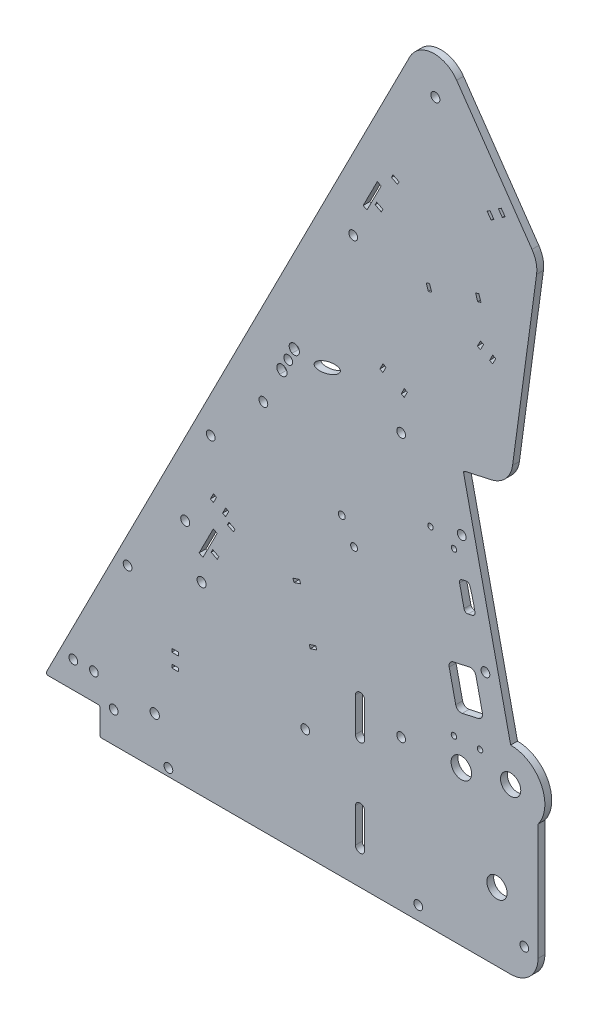
from build123d import *

# Parameters (mm, degrees)
BOSS_EXTRUDE1_DEPTH     = 3.175
SKETCH2_R               = 2.0955
SKETCH2_R_2             = 2.032
SKETCH2_R_3             = 4.699
CUT_EXTRUDE1_DEPTH      = 421.976111717
SKETCH7_R               = 2.159
CUT_EXTRUDE2_DEPTH      = 421.976111717
CUT_EXTRUDE3_REACH      = 422.976
SKETCH10_R              = 2.032
FILLET1_R               = 12.7
FILLET2_R               = 0.79375
SKETCH12_R              = 2.032
CUT_EXTRUDE5_DEPTH      = 411.989226146
CUT_EXTRUDE6_DEPTH      = 411.989226146
CUT_EXTRUDE6_DEPTH_BACK = 411.989226146
SKETCH13_R              = 1.27
SKETCH14_R              = 2.032
SKETCH14_R_2            = 1.6
SKETCH14_RX             = 6.35
SKETCH14_RY             = 2.38125
SKETCH14_W              = 3.175
SKETCH14_H              = 1.5875
CUT_EXTRUDE7_DEPTH      = 411.989226146
SKETCH15_R              = 2.032
CUT_EXTRUDE8_DEPTH      = 411.989226285
FILLET3_R               = 2.54
SKETCH16_R              = 4.7625
CUT_EXTRUDE9_DEPTH      = 411.989226285


with BuildPart() as part:
    # Sketch1 → Boss-Extrude1 (new body)
    with BuildSketch(Plane.XY):
        with BuildLine():
            Line((228.6, -12.7), (228.6, 53.975))
            ThreePointArc((228.6, 53.975), (230.099031657, 70.599515829), (215.9, 79.375))
            Line((215.9, 79.375), (193.909735224, 178.566674323))
            Line((193.909735224, 178.566674323), (215.607913982, 183.377044743))
            Line((215.607913982, 183.377044743), (228.6, 279.4))
            Line((228.6, 279.4), (178.754725958, 351.413083686))
            Line((178.754725958, 351.413083686), (0, 0))
            Line((0, 0), (25.4, 0))
            Line((25.4, 0), (25.4, -12.7))
            Line((25.4, -12.7), (228.6, -12.7))
        make_face()
    extrude(amount=BOSS_EXTRUDE1_DEPTH)

    # Sketch2 → Cut-Extrude1 (cut, through all)
    with BuildSketch(Plane.XY.offset(3.175)):
        with Locations((64.943150167, 94.057839899)):
            Circle(SKETCH2_R)
        with Locations((180.975, 322.164313376)):
            Circle(SKETCH2_R)
        with Locations((72.544547852, 73.173171402)):
            Circle(SKETCH2_R)
        with Locations((193.207821773, 152.394364194)):
            Circle(SKETCH2_R_2)
        with Locations((215.9, 63.5)):
            Circle(SKETCH2_R_3)
        with Locations((173.0375, -6.35)):
            Circle(SKETCH2_R_2)
        with Locations((204.202954161, 102.798527032)):
            Circle(SKETCH2_R_2)
        with Locations((209.55, 19.05)):
            Circle(SKETCH2_R_3)
        with Locations((165.1, 179.3875)):
            Circle(SKETCH2_R_2)
    extrude(amount=-CUT_EXTRUDE1_DEPTH, mode=Mode.SUBTRACT)

    # Sketch7 → Cut-Extrude2 (cut, through all)
    with BuildSketch(Plane.XY.offset(3.175)):
        with Locations((50.8, 9.525)):
            Circle(SKETCH7_R)
        with BuildLine():
            Line((143.891, 3.175), (143.891, 19.05))
            ThreePointArc((143.891, 19.05), (146.05, 21.209), (148.209, 19.05))
            Line((148.209, 19.05), (148.209, 3.175))
            ThreePointArc((148.209, 3.175), (146.05, 1.016), (143.891, 3.175))
        make_face()
        with BuildLine():
            Line((143.891, 47.625), (143.891, 63.5))
            ThreePointArc((143.891, 63.5), (146.05, 65.659), (148.209, 63.5))
            Line((148.209, 63.5), (148.209, 47.625))
            ThreePointArc((148.209, 47.625), (146.05, 45.466), (143.891, 47.625))
        make_face()
    extrude(amount=-CUT_EXTRUDE2_DEPTH, mode=Mode.SUBTRACT)

    # Sketch10 → Cut-Extrude3 (cut, up to next)
    with BuildSketch(Plane.XY.offset(3.175), mode=Mode.PRIVATE) as cut_extrude3_sk1:
        with Locations((165.1, 57.15)):
            Circle(SKETCH10_R)
    cut_extrude3_tool1 = extrude(cut_extrude3_sk1.sketch, amount=-CUT_EXTRUDE3_REACH, mode=Mode.PRIVATE) & part.part
    # Sketch10 → Cut-Extrude3 (cut, up to next)
    with BuildSketch(Plane.XY.offset(3.175), mode=Mode.PRIVATE) as cut_extrude3_sk2:
        with Locations((120.65, 38.1)):
            Circle(SKETCH10_R)
    cut_extrude3_tool2 = extrude(cut_extrude3_sk2.sketch, amount=-CUT_EXTRUDE3_REACH, mode=Mode.PRIVATE) & part.part
    # Sketch10 → Cut-Extrude3 (cut, up to next)
    with BuildSketch(Plane.XY.offset(3.175), mode=Mode.PRIVATE) as cut_extrude3_sk3:
        with Locations((13.046467246, 12.334704411)):
            Circle(SKETCH10_R)
    cut_extrude3_tool3 = extrude(cut_extrude3_sk3.sketch, amount=-CUT_EXTRUDE3_REACH, mode=Mode.PRIVATE) & part.part
    # Sketch10 → Cut-Extrude3 (cut, up to next)
    with BuildSketch(Plane.XY.offset(3.175), mode=Mode.PRIVATE) as cut_extrude3_sk4:
        with Locations((22.571467246, 12.334704411)):
            Circle(SKETCH10_R)
    cut_extrude3_tool4 = extrude(cut_extrude3_sk4.sketch, amount=-CUT_EXTRUDE3_REACH, mode=Mode.PRIVATE) & part.part
    # Sketch10 → Cut-Extrude3 (cut, up to next)
    with BuildSketch(Plane.XY.offset(3.175), mode=Mode.PRIVATE) as cut_extrude3_sk5:
        with Locations((38.211447917, 62.639810909)):
            Circle(SKETCH10_R)
    cut_extrude3_tool5 = extrude(cut_extrude3_sk5.sketch, amount=-CUT_EXTRUDE3_REACH, mode=Mode.PRIVATE) & part.part
    add(cut_extrude3_tool1.solids().sort_by_distance((165.1, 57.15, 3.175))[0], mode=Mode.SUBTRACT)
    add(cut_extrude3_tool2.solids().sort_by_distance((120.65, 38.1, 3.175))[0], mode=Mode.SUBTRACT)
    add(cut_extrude3_tool3.solids().sort_by_distance((13.046467, 12.334704, 3.175))[0], mode=Mode.SUBTRACT)
    add(cut_extrude3_tool4.solids().sort_by_distance((22.571467, 12.334704, 3.175))[0], mode=Mode.SUBTRACT)
    add(cut_extrude3_tool5.solids().sort_by_distance((38.211448, 62.639811, 3.175))[0], mode=Mode.SUBTRACT)

    # Fillet1
    fillet1_edges = [part.edges().sort_by_distance(p)[0] for p in [
        (228.6, -12.7, 1.5875),
        (178.754725958, 351.413083686, 1.5875),
        (215.607913982, 183.377044743, 1.5875),
        (228.6, 279.4, 1.5875),
    ]]
    fillet(fillet1_edges, radius=FILLET1_R)

    # Fillet2
    fillet2_edges = [part.edges().sort_by_distance(p)[0] for p in [
        (25.4, -12.7, 1.5875),
        (25.4, 0, 1.5875),
        (193.909735224, 178.566674323, 1.5875),
        (0, 0, 1.5875),
    ]]
    fillet(fillet2_edges, radius=FILLET2_R)

    # Sketch12 → Cut-Extrude5 (cut, through all)
    with BuildSketch(Plane.XY.offset(3.175)):
        with Locations((31.75, 1.5875)):
            Circle(SKETCH12_R)
        with Locations((222.25, 1.5875)):
            Circle(SKETCH12_R)
        with Locations((57.15, -9.2075)):
            Circle(SKETCH12_R)
    extrude(amount=-CUT_EXTRUDE5_DEPTH, mode=Mode.SUBTRACT)

    # Sketch13 → Cut-Extrude6 (cut, two sides: drawn at the far end of the back side and taken through both)
    with BuildSketch(Plane.XY.offset(3.175).offset(-CUT_EXTRUDE6_DEPTH_BACK)):
        with Locations((189.602197334, 69.980636704)):
            Circle(SKETCH13_R)
        with Locations((201.708862449, 70.509225118)):
            Circle(SKETCH13_R)
        with Locations((178.721644858, 148.532438598)):
            Circle(SKETCH13_R)
        with Locations((189.622629605, 145.09537131)):
            Circle(SKETCH13_R)
        Polygon((186.844411154, 98.950230697), (199.243370445, 101.699013794), (203.36654509, 83.100574858), (190.9675858, 80.351791761), align=None)
        with BuildLine():
            Line((195.12807169, 134.933592333), (193.415301921, 134.553880417))
            ThreePointArc((193.415301921, 134.553880417), (192.420015888, 133.856973634), (192.209029897, 132.660412618))
            Line((192.209029897, 132.660412618), (194.270617219, 123.361193151))
            ThreePointArc((194.270617219, 123.361193151), (194.967524002, 122.365907117), (196.164085018, 122.154921126))
            Line((196.164085018, 122.154921126), (198.109091879, 122.586118766))
            ThreePointArc((198.109091879, 122.586118766), (199.082720469, 123.249946547), (199.330550026, 124.401988414))
            ThreePointArc((199.330550026, 124.401988414), (198.332361402, 129.18494451), (196.979617949, 133.879956193))
            ThreePointArc((196.979617949, 133.879956193), (196.256822614, 134.763465498), (195.12807169, 134.933592333))
        make_face()
    extrude(amount=CUT_EXTRUDE6_DEPTH + CUT_EXTRUDE6_DEPTH_BACK, mode=Mode.SUBTRACT)

    # Sketch14 → Cut-Extrude7 (cut, through all)
    with BuildSketch(Plane.XY.offset(3.175)):
        with Locations((142.875, 247.65)):
            Circle(SKETCH14_R)
        with Locations((112.7125, 182.5625)):
            Circle(SKETCH14_R)
        with Locations((101.196445848, 159.923142748)):
            Circle(SKETCH14_R)
        with Locations((-3.671542088, -75.371419893)):
            Circle(SKETCH14_R_2)
        with Locations((-8.840164817, -85.532391258)):
            Circle(SKETCH14_R_2)
        with Locations((137.55915364, 132.520983187)):
            Circle(SKETCH14_R_2)
        with Locations((143.25915364, 122.648293584)):
            Circle(SKETCH14_R_2)
        with Locations(Location((130.826142263, 188.461522288), (0, 0, -161.961260538))):
            Ellipse(SKETCH14_RX, SKETCH14_RY)
        Polygon((147.482742003, 261.9243054), (154.04689287, 274.828739034), (155.829519425, 273.921963116), (149.265368558, 261.017529483), align=None)
        Polygon((160.590482388, 279.78010172), (161.310235773, 281.195061549), (164.140155429, 279.75555478), (163.420402045, 278.340594951), align=None)
        Polygon((153.789663007, 266.410402556), (156.619582664, 264.970895787), (155.899829279, 263.555935959), (153.069909623, 264.995442728), align=None)
        Polygon((178.26972852, 245.992253978), (179.240391581, 242.969268992), (177.728899089, 242.483937462), (176.758236028, 245.506922447), align=None)
        Polygon((200.609634347, 249.830809719), (199.638971286, 252.853794704), (201.150463779, 253.339126235), (202.12112684, 250.316141249), align=None)
        Polygon((77.953373051, 97.225512031), (79.735999607, 96.318736114), (73.17184874, 83.41430248), (71.389222185, 84.321078398), align=None)
        Polygon((85.216715955, 103.591834546), (84.49696257, 102.176874718), (87.326882227, 100.737367949), (88.046635611, 102.152327777), align=None)
        Polygon((156.643043941, 199.39992488), (158.08255071, 202.229844536), (156.667590882, 202.949597921), (155.228084113, 200.119678264), align=None)
        Polygon((165.132802911, 195.081404573), (166.57230968, 197.911324229), (167.987269508, 197.191570845), (166.547762739, 194.361651188), align=None)
        Polygon((77.696143189, 88.807175554), (76.976389805, 87.392215725), (79.806309461, 85.952708956), (80.526062846, 87.367668785), align=None)
        Polygon((201.915382504, 234.74968075), (200.475875735, 231.919761094), (201.890835563, 231.200007709), (203.330342332, 234.029927366), align=None)
        Polygon((206.135715047, 229.040747556), (207.575221816, 231.870667212), (208.990181645, 231.150913828), (207.550674876, 228.320994171), align=None)
        Polygon((205.013971437, 288.371538288), (206.820969573, 285.760909487), (208.126283974, 286.664408555), (206.319285837, 289.275037356), align=None)
        Polygon((210.235229039, 291.98553456), (212.042227175, 289.374905759), (213.347541575, 290.278404827), (211.540543439, 292.889033628), align=None)
        Polygon((122.453385221, 73.10367975), (122.951215646, 71.596257739), (125.966059667, 72.591918589), (125.468229242, 74.099340599), align=None)
        Polygon((114.917306673, 95.922796693), (115.415137097, 94.415374682), (118.429981119, 95.411035531), (117.932150694, 96.918457542), align=None)
        with Locations((60.325, 38.89375)):
            Rectangle(SKETCH14_W, SKETCH14_H)
        with Locations((60.325, 32.54375)):
            Rectangle(SKETCH14_W, SKETCH14_H)
        Polygon((78.051560814, 111.424204195), (76.612054045, 108.594284538), (78.027013874, 107.874531154), (79.466520643, 110.70445081), align=None)
        Polygon((82.271893358, 105.715271), (83.711400127, 108.545190657), (85.126359956, 107.825437272), (83.686853187, 104.995517616), align=None)
        with BuildLine():
            add(Edge.make_bspline(
                [(108.753856385, 174.780220945), (110.821723963, 173.728350313), (111.90135404, 175.850790056), (112.980984117, 177.973229798), (110.913116539, 179.025100429)],
                knots=[0, 0, 0, 1.570796327, 1.570796327, 3.141592654, 3.141592654, 3.141592654], degree=2, weights=[1, 0.707106781, 1, 0.707106781, 1]))
            add(Edge.make_bspline(
                [(110.913116539, 179.025100429), (110.77268373, 179.096534959), (110.626511301, 179.154391231), (110.322493118, 179.242488117), (110.165373026, 179.272144601), (109.695542578, 179.315227584), (109.373415846, 179.283109915), (108.9218002, 179.145618276), (108.77365547, 179.084104344), (108.495402792, 178.934315945), (108.365007933, 178.846412483), (108.121928357, 178.644218756), (108.0096946, 178.529696631), (107.813416216, 178.283892413), (107.727754596, 178.151249117), (107.58342172, 177.86715543), (107.526957985, 177.720181494), (107.444132542, 177.416788403), (107.417775942, 177.25846019), (107.397765558, 176.943245973), (107.403605499, 176.786285249), (107.446503964, 176.473637327), (107.48413539, 176.317513381), (107.58741463, 176.020451076), (107.653173274, 175.877669132), (107.813265642, 175.6037409), (107.906595752, 175.474826714), (108.217757093, 175.120973916), (108.473611136, 174.922774438), (108.753856385, 174.780220945)],
                knots=[0, 0, 0, 0, 0.0625, 0.0625, 0.125, 0.125, 0.25, 0.25, 0.3125, 0.3125, 0.375, 0.375, 0.4375, 0.4375, 0.5, 0.5, 0.5625, 0.5625, 0.625, 0.625, 0.6875, 0.6875, 0.75, 0.75, 0.8125, 0.8125, 0.875, 0.875, 1, 1, 1, 1], degree=3))
        make_face()
        with BuildLine():
            add(Edge.make_bspline(
                [(114.511883461, 186.099899571), (116.579751039, 185.048028939), (117.659381116, 187.170468682), (118.739011193, 189.292908424), (116.671143615, 190.344779055)],
                knots=[0, 0, 0, 1.570796327, 1.570796327, 3.141592654, 3.141592654, 3.141592654], degree=2, weights=[1, 0.707106781, 1, 0.707106781, 1]))
            add(Edge.make_bspline(
                [(114.511883461, 186.099899571), (114.371072576, 186.171526418), (114.235866303, 186.257351722), (113.987547839, 186.450065421), (113.872855617, 186.557654504), (113.558328181, 186.915480737), (113.397407635, 187.190062471), (113.24126374, 187.640077887), (113.204646123, 187.792957095), (113.161785412, 188.104373095), (113.155794463, 188.264784445), (113.176022459, 188.579744294), (113.201753482, 188.734678369), (113.28477823, 189.039401247), (113.342554455, 189.189068059), (113.556262174, 189.609540487), (113.758638915, 189.862727621), (114.121215939, 190.164706401), (114.254157477, 190.254446578), (114.53236698, 190.404090785), (114.677524715, 190.464472802), (114.97978581, 190.556739169), (115.136913319, 190.588175808), (115.449881014, 190.619878989), (115.607376248, 190.620744977), (115.924438129, 190.591785045), (116.079517328, 190.562319108), (116.3815103, 190.475083726), (116.53003913, 190.416555249), (116.671143615, 190.344779055)],
                knots=[0, 0, 0, 0, 0.0625, 0.0625, 0.125, 0.125, 0.25, 0.25, 0.3125, 0.3125, 0.375, 0.375, 0.4375, 0.4375, 0.5, 0.5, 0.625, 0.625, 0.6875, 0.6875, 0.75, 0.75, 0.8125, 0.8125, 0.875, 0.875, 0.9375, 0.9375, 1, 1, 1, 1], degree=3))
        make_face()
    extrude(amount=-CUT_EXTRUDE7_DEPTH, mode=Mode.SUBTRACT)

    # Sketch15 → Cut-Extrude8 (cut, through all)
    with BuildSketch(Plane.XY.offset(3.175)):
        with Locations((76.786819993, 134.148053636)):
            Circle(SKETCH15_R)
        with Locations((-0.801017029, -29.586046243)):
            Circle(SKETCH15_R)
        with Locations((-6.559044104, -40.905724869)):
            Circle(SKETCH15_R)
    extrude(amount=-CUT_EXTRUDE8_DEPTH, mode=Mode.SUBTRACT)

    # Fillet3
    fillet3_edges = [part.edges().sort_by_distance(p)[0] for p in [
        (199.243370445, 101.699013794, 1.5875),
        (186.844411154, 98.950230697, 1.5875),
        (190.9675858, 80.351791761, 1.5875),
        (203.36654509, 83.100574858, 1.5875),
    ]]
    fillet(fillet3_edges, radius=FILLET3_R)

    # Sketch16 → Cut-Extrude9 (cut, through all)
    with BuildSketch(Plane.XY.offset(3.175)):
        with Locations((193.04, 58.801)):
            Circle(SKETCH16_R)
    extrude(amount=-CUT_EXTRUDE9_DEPTH, mode=Mode.SUBTRACT)


solid = part.part
